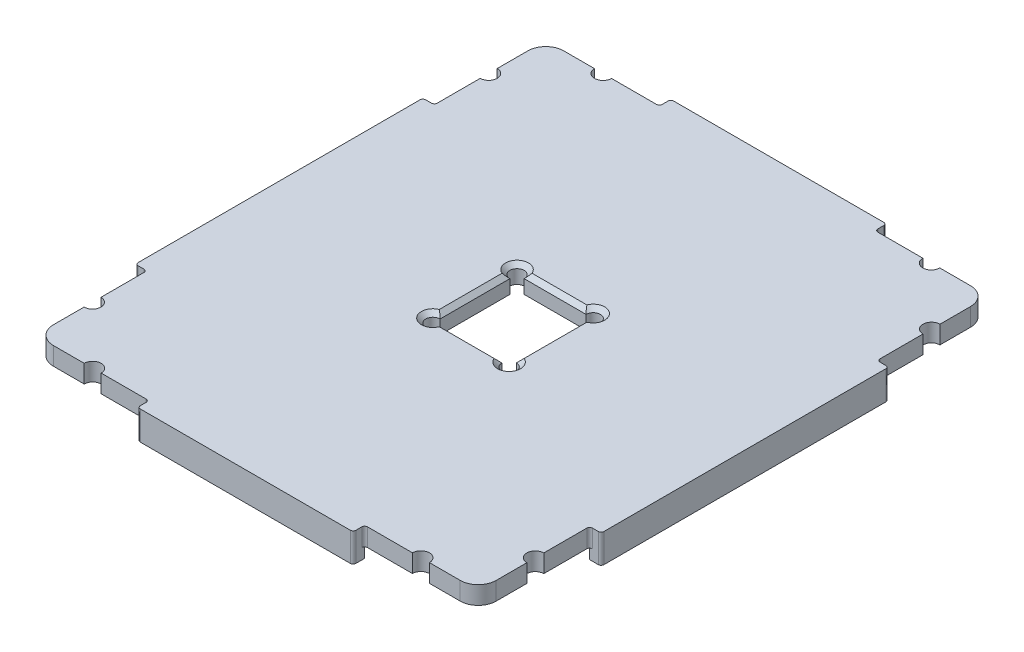
from build123d import *
from OCP.BRepAlgoAPI import BRepAlgoAPI_Cut
from OCP.TopTools import TopTools_ListOfShape

# Parameters (mm, degrees)
SKETCH1_W           = 78.232
SKETCH1_H           = 90.17
BOSS_EXTRUDE1_DEPTH = 3.175
FILLET1_R           = 3.175
SKETCH2_W           = 2.032
SKETCH2_H           = 50.8
SKETCH2_W_2         = 38.1
SKETCH2_H_2         = 2.032
BOSS_EXTRUDE2_DEPTH = 5.08
FILLET3_R           = 0.508
CUT_EXTRUDE1_DEPTH  = 63.761267046
CHAMFER2_SIZE       = 0.762


with BuildPart() as part:
    # Sketch1 → Boss-Extrude1 (new body)
    with BuildSketch(Plane(origin=(0, 0, 0), x_dir=(1, 0, 0), z_dir=(0, 1, 0))):
        Rectangle(SKETCH1_W, SKETCH1_H)
        with BuildLine():
            Line((-5.334, 7.493), (5.588, 7.493))
            ThreePointArc((5.588, 7.493), (7.756025612, 8.391025612), (6.858, 6.223))
            Line((6.858, 6.223), (6.858, -6.096))
            ThreePointArc((6.858, -6.096), (7.756025612, -8.264025612), (5.588, -7.366))
            Line((5.588, -7.366), (-5.334, -7.366))
            ThreePointArc((-5.334, -7.366), (-7.502025612, -8.264025612), (-6.604, -6.096))
            Line((-6.604, -6.096), (-6.604, 6.223))
            ThreePointArc((-6.604, 6.223), (-7.502025612, 8.391025612), (-5.334, 7.493))
        make_face(mode=Mode.SUBTRACT)
    extrude(amount=BOSS_EXTRUDE1_DEPTH)

    # Fillet1
    fillet1_edges = [part.edges().sort_by_distance(p)[0] for p in [
        (-39.116, 1.5875, -45.085),
        (39.116, 1.5875, -45.085),
        (39.116, 1.5875, 45.085),
        (-39.116, 1.5875, 45.085),
    ]]
    fillet(fillet1_edges, radius=FILLET1_R)


with BuildPart() as boss_extrude2_tool:
    # Sketch2 → Boss-Extrude2 (new body)
    with BuildSketch(Plane(origin=(0, 3.175, 0), x_dir=(1, 0, 0), z_dir=(0, 1, 0))):
        Polygon((19.049995564, -47.117005476), (19.049995755, -45.085005476), (-19.050004245, -45.085001889), (-19.050004436, -47.117001889), align=None)
        with Locations((-40.132001661, 0)):
            Rectangle(SKETCH2_W, SKETCH2_H)
        with Locations((0, 46.101)):
            Rectangle(SKETCH2_W_2, SKETCH2_H_2)
        with Locations((40.132001661, 0)):
            Rectangle(SKETCH2_W, SKETCH2_H)
    extrude(amount=-BOSS_EXTRUDE2_DEPTH)


with BuildPart() as part_1:
    add(part.part)


with BuildPart() as part_2:
    # Boss-Extrude2: joined with boss_extrude2_tool
    add(part_1.part.fuse(boss_extrude2_tool.part, tol=0.00001))

    # Fillet3
    fillet3_edges = [part_2.edges().sort_by_distance(p)[0] for p in [
        (-39.116001661, 1.5875, 25.4),
        (-41.148001661, 0.635, 25.4),
        (-41.148001661, 0.635, -25.4),
        (-39.116001661, 1.5875, -25.4),
        (-19.05, 0.635, -47.117),
        (-19.05, 1.5875, -45.085),
        (19.05, 0.635, -47.117),
        (19.05, 1.5875, -45.085),
        (39.116001661, 1.5875, -25.4),
        (41.148001661, 0.635, -25.4),
        (41.148001661, 0.635, 25.4),
        (39.116001661, 1.5875, 25.4),
        (19.049995564, 0.635, 47.117005476),
        (19.049995755, 1.5875, 45.085005476),
        (-19.050004436, 0.635, 47.117001889),
        (-19.050004245, 1.5875, 45.085001889),
    ]]
    fillet(fillet3_edges, radius=FILLET3_R)


with BuildPart() as cut_extrude1_tool:
    # Sketch3 → Cut-Extrude1 (new, through all)
    with BuildSketch(Plane(origin=(0, 3.175, 0), x_dir=(1, 0, 0), z_dir=(0, 1, 0))):
        with BuildLine():
            Line((-39.116, 36.5), (-39.116, 33.5))
            ThreePointArc((-39.116, 33.5), (-37.616, 35), (-39.116, 36.5))
        make_face()
        with BuildLine():
            Line((-27.5, 45.085), (-30.5, 45.085))
            ThreePointArc((-30.5, 45.085), (-29, 43.585), (-27.5, 45.085))
        make_face()
        with BuildLine():
            Line((27.499999809, 45.084997268), (30.499999809, 45.084997268))
            ThreePointArc((30.499999809, 45.084997268), (28.999999809, 43.584997268), (27.499999809, 45.084997268))
        make_face()
        with BuildLine():
            Line((39.115998859, 36.499996315), (39.115998859, 33.499996315))
            ThreePointArc((39.115998859, 33.499996315), (37.615998859, 34.999996315), (39.115998859, 36.499996315))
        make_face()
        with BuildLine():
            Line((39.115998859, -33.499996315), (39.115998859, -36.499996315))
            ThreePointArc((39.115998859, -36.499996315), (37.615998859, -34.999996315), (39.115998859, -33.499996315))
        make_face()
        with BuildLine():
            Line((30.499999809, -45.084997268), (27.499999809, -45.084997268))
            ThreePointArc((27.499999809, -45.084997268), (28.999999809, -43.584997268), (30.499999809, -45.084997268))
        make_face()
        with BuildLine():
            Line((-27.5, -45.085), (-30.5, -45.085))
            ThreePointArc((-30.5, -45.085), (-29, -43.585), (-27.5, -45.085))
        make_face()
        with BuildLine():
            Line((-39.116, -36.5), (-39.116, -33.5))
            ThreePointArc((-39.116, -33.5), (-37.616, -35), (-39.116, -36.5))
        make_face()
    extrude(amount=-CUT_EXTRUDE1_DEPTH)


with BuildPart() as part_3:
    add(part_2.part)

    # Cut-Extrude1: cut by cut_extrude1_tool, with a tolerance
    cut_extrude1_stock = TopTools_ListOfShape()
    cut_extrude1_stock.Append(part_3.part.wrapped)
    cut_extrude1_tools = TopTools_ListOfShape()
    cut_extrude1_tools.Append(cut_extrude1_tool.part.wrapped)
    cut_extrude1_cut = BRepAlgoAPI_Cut()
    cut_extrude1_cut.SetArguments(cut_extrude1_stock)
    cut_extrude1_cut.SetTools(cut_extrude1_tools)
    cut_extrude1_cut.SetFuzzyValue(0.00001)
    cut_extrude1_cut.Build()
    add(Compound.cast(cut_extrude1_cut.Shape()).solids(), mode=Mode.REPLACE)

    # Chamfer2
    chamfer2_edges = [part_3.edges().sort_by_distance(p)[0] for p in [
        (-7.502025612, 3.175, 8.264025612),
        (0.127, 3.175, 7.366),
        (7.756025612, 3.175, 8.264025612),
        (6.858, 3.175, -0.0635),
        (7.756025612, 3.175, -8.391025612),
        (-6.604, 3.175, -0.0635),
        (-7.502025612, 3.175, -8.391025612),
        (0.127, 3.175, -7.493),
    ]]
    chamfer(chamfer2_edges, length=CHAMFER2_SIZE)


solid = part_3.part
